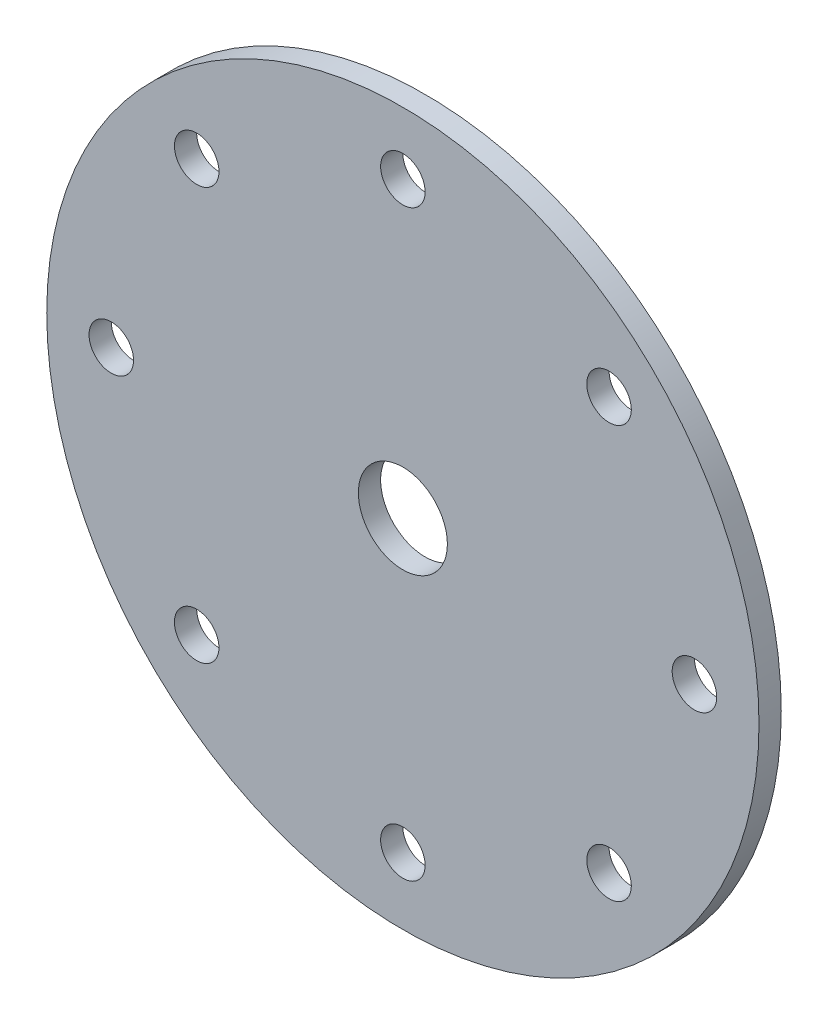
from build123d import *

# Parameters (mm, degrees)
SKETCH1_R        = 101.6
SKETCH1_R_2      = 6.35
SKETCH1_R_3      = 12.7
ROTOR_DISC_DEPTH = 6.35


with BuildPart() as part:
    # Sketch1 → Rotor Disc (new body)
    with BuildSketch(Plane.XY):
        Circle(SKETCH1_R)
        with Locations((-58.820677593, -58.185677593)):
            Circle(SKETCH1_R_2, mode=Mode.SUBTRACT)
        Circle(SKETCH1_R_3, mode=Mode.SUBTRACT)
        with Locations((0, -82.55)):
            Circle(SKETCH1_R_2, mode=Mode.SUBTRACT)
        with Locations((58.820677593, -58.185677593)):
            Circle(SKETCH1_R_2, mode=Mode.SUBTRACT)
        with Locations((-83.185, 0.635)):
            Circle(SKETCH1_R_2, mode=Mode.SUBTRACT)
        with Locations((-58.820677593, 59.455677593)):
            Circle(SKETCH1_R_2, mode=Mode.SUBTRACT)
        with Locations((0, 83.82)):
            Circle(SKETCH1_R_2, mode=Mode.SUBTRACT)
        with Locations((83.185, 0.635)):
            Circle(SKETCH1_R_2, mode=Mode.SUBTRACT)
        with Locations((58.820677593, 59.455677593)):
            Circle(SKETCH1_R_2, mode=Mode.SUBTRACT)
    extrude(amount=ROTOR_DISC_DEPTH)


solid = part.part
